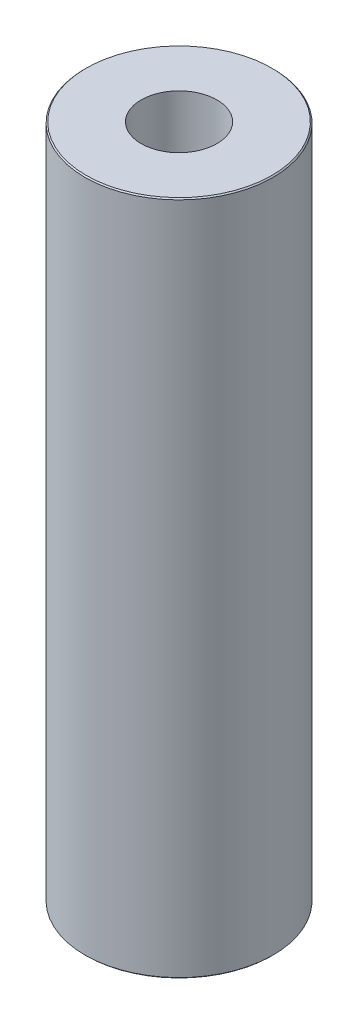
from build123d import *

# Parameters (mm, degrees)
SKETCH1_R           = 27.5
BOSS_EXTRUDE1_DEPTH = 197.6171704
SKETCH2_R           = 11.08700219
CUT_EXTRUDE1_DEPTH  = 202.407661316
CHAMFER1_SIZE       = 0.341667249


with BuildPart() as part:
    # Sketch1 → Boss-Extrude1 (new body)
    with BuildSketch(Plane(origin=(0, 0, 0), x_dir=(1, 0, 0), z_dir=(0, 1, 0))):
        Circle(SKETCH1_R)
    extrude(amount=BOSS_EXTRUDE1_DEPTH)

    # Sketch2 → Cut-Extrude1 (cut, through all)
    with BuildSketch(Plane(origin=(0, 0, 0), x_dir=(1, 0, 0), z_dir=(0, 1, 0))):
        Circle(SKETCH2_R)
    extrude(amount=CUT_EXTRUDE1_DEPTH, mode=Mode.SUBTRACT)

    # Chamfer1
    chamfer1_edges = [part.edges().sort_by_distance(p)[0] for p in [
        (-27.5, 197.6171704, 0),
        (-27.5, 0, 0),
    ]]
    chamfer(chamfer1_edges, length=CHAMFER1_SIZE)


solid = part.part
